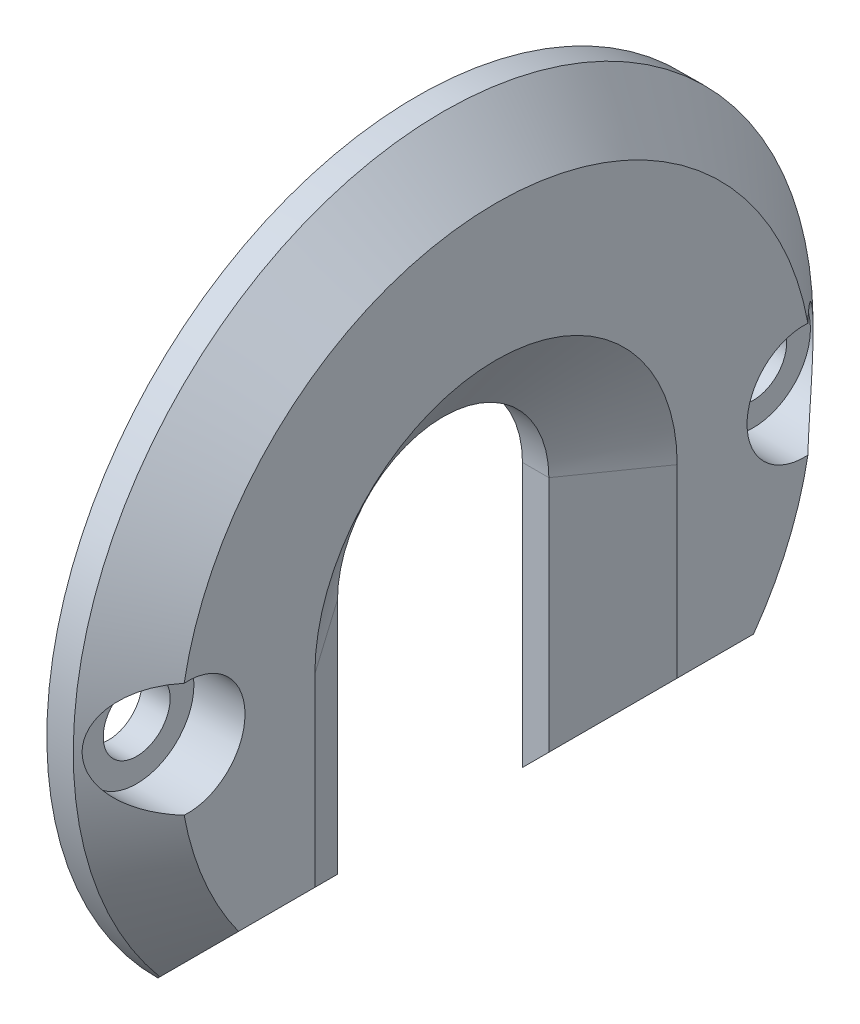
from build123d import *
from OCP.BRepFilletAPI import BRepFilletAPI_MakeChamfer

# Parameters (mm, degrees)
BOSS_EXTRUDE1_DEPTH                                 = 4.5
BOSS_EXTRUDE2_REACH                                 = 32.037
BOSS_EXTRUDE2_END_RADIUS                            = 21
BOSS_EXTRUDE2_DIRECTION_2_REACH                     = 32.037
BOSS_EXTRUDE2_DIRECTION_2_END_RADIUS                = 21
CUT_EXTRUDE1_REACH                                  = 32.037
CUT_EXTRUDE1_DIRECTION_2_REACH                      = 32.037
CBORE_FOR_M3_HEX_SOCKET_HEAD_CAP_SCREW1_D           = 3.8
CBORE_FOR_M3_HEX_SOCKET_HEAD_CAP_SCREW1_DEPTH       = 7
CBORE_FOR_M3_HEX_SOCKET_HEAD_CAP_SCREW1_CBORE_D     = 6.5
CBORE_FOR_M3_HEX_SOCKET_HEAD_CAP_SCREW1_CBORE_DEPTH = 2.9
CBORE_FOR_M3_HEX_SOCKET_HEAD_CAP_SCREW1_TIP         = 1.141635176
CHAMFER1_SIZE                                       = 3
CHAMFER1_SIZE2                                      = 4.28444402
CHAMFER2_SIZE                                       = 3


with BuildPart() as part:
    # Sketch1 → Boss-Extrude1 (new body)
    with BuildSketch(Plane(origin=(0, 0, 0), x_dir=(0, 0, -1), z_dir=(1, 0, 0))):
        with BuildLine():
            Line((-6, -10.5), (-6, 0))
            ThreePointArc((-6, 0), (0, 6), (6, 0))
            Line((6, 0), (6, -10.5))
            Line((6, -10.5), (18.186533479, -10.5))
            ThreePointArc((18.186533479, -10.5), (0, 21), (-18.186533479, -10.5))
            Line((-18.186533479, -10.5), (-6, -10.5))
        make_face()
    extrude(amount=BOSS_EXTRUDE1_DEPTH)

    # Boss-Extrude2: up to this cylinder (the profile starts inside it)
    boss_extrude2_end = Plane(origin=(1.5, 0, 0), z_dir=(-1, 0, 0)) * Cylinder(BOSS_EXTRUDE2_END_RADIUS, 107.074, mode=Mode.PRIVATE)
    # Sketch2 → Boss-Extrude2 (add, up to the surface)
    with BuildSketch(Plane.XY, mode=Mode.PRIVATE) as boss_extrude2_sk1:
        Polygon((4.5, -10.5), (0, -15), (0, -10.5), align=None)
    boss_extrude2_tool1 = extrude(boss_extrude2_sk1.sketch, amount=-BOSS_EXTRUDE2_REACH, mode=Mode.PRIVATE) & boss_extrude2_end
    add(boss_extrude2_tool1.solids().sort_by_distance((1.5, -12, 0))[0])

    # Boss-Extrude2 direction 2: up to this cylinder (the profile starts inside it)
    boss_extrude2_direction_2_end = Plane(origin=(1.5, 0, 0), z_dir=(-1, 0, 0)) * Cylinder(BOSS_EXTRUDE2_DIRECTION_2_END_RADIUS, 107.074, mode=Mode.PRIVATE)
    # Sketch2 → Boss-Extrude2 direction 2 (add, up to the surface)
    with BuildSketch(Plane.XY, mode=Mode.PRIVATE) as boss_extrude2_direction_2_sk1:
        Polygon((4.5, -10.5), (0, -15), (0, -10.5), align=None)
    boss_extrude2_direction_2_tool1 = extrude(boss_extrude2_direction_2_sk1.sketch, amount=BOSS_EXTRUDE2_DIRECTION_2_REACH, mode=Mode.PRIVATE) & boss_extrude2_direction_2_end
    add(boss_extrude2_direction_2_tool1.solids().sort_by_distance((1.5, -12, 0))[0])

    # Cut-Extrude1: up to this face of the body (flat: up to its plane)
    cut_extrude1_end = Plane(part.part.faces().sort_by_distance((2.25, -5.25, -6))[0])
    # Sketch2<2> → Cut-Extrude1 (cut, up to the picked face)
    with BuildSketch(Plane.XY, mode=Mode.PRIVATE) as cut_extrude1_sk1:
        Polygon((4.5, -10.5), (0, -15), (0, -10.5), align=None)
    cut_extrude1_tool1 = split(extrude(cut_extrude1_sk1.sketch, amount=-CUT_EXTRUDE1_REACH, mode=Mode.PRIVATE), bisect_by=cut_extrude1_end, keep=Keep.BOTH, mode=Mode.PRIVATE)
    add(cut_extrude1_tool1.solids().sort_by(Axis((1.5, -12, 0), (0, 0, -1)))[0], mode=Mode.SUBTRACT)

    # Cut-Extrude1 direction 2: up to this face of the body (flat: up to its plane)
    cut_extrude1_direction_2_end = Plane(part.part.faces().sort_by_distance((2.25, -5.25, 6))[0])
    # Sketch2<2> → Cut-Extrude1 direction 2 (cut, up to the picked face)
    with BuildSketch(Plane.XY, mode=Mode.PRIVATE) as cut_extrude1_direction_2_sk1:
        Polygon((4.5, -10.5), (0, -15), (0, -10.5), align=None)
    cut_extrude1_direction_2_tool1 = split(extrude(cut_extrude1_direction_2_sk1.sketch, amount=CUT_EXTRUDE1_DIRECTION_2_REACH, mode=Mode.PRIVATE), bisect_by=cut_extrude1_direction_2_end, keep=Keep.BOTH, mode=Mode.PRIVATE)
    add(cut_extrude1_direction_2_tool1.solids().sort_by(Axis((1.5, -12, 0), (0, 0, 1)))[0], mode=Mode.SUBTRACT)

    # CBORE for M3 Hex Socket Head Cap Screw1
    with Locations(Plane(origin=(4.5, 0, 0), x_dir=(0, 0, -1), z_dir=(1, 0, 0))):
        with Locations((-17.5, 0), (17.5, 0)):
            CounterBoreHole(CBORE_FOR_M3_HEX_SOCKET_HEAD_CAP_SCREW1_D / 2, CBORE_FOR_M3_HEX_SOCKET_HEAD_CAP_SCREW1_CBORE_D / 2, CBORE_FOR_M3_HEX_SOCKET_HEAD_CAP_SCREW1_CBORE_DEPTH, depth=CBORE_FOR_M3_HEX_SOCKET_HEAD_CAP_SCREW1_DEPTH)
            with Locations((0, 0, -(CBORE_FOR_M3_HEX_SOCKET_HEAD_CAP_SCREW1_DEPTH + CBORE_FOR_M3_HEX_SOCKET_HEAD_CAP_SCREW1_TIP / 2))):  # 118° drill point
                Cone(0, CBORE_FOR_M3_HEX_SOCKET_HEAD_CAP_SCREW1_D / 2, CBORE_FOR_M3_HEX_SOCKET_HEAD_CAP_SCREW1_TIP, mode=Mode.SUBTRACT)

    # Chamfer1: one chamfer whose edges measure the first distance from different faces: ONE call of the kernel's chamfer builder (chamfer() names one face for all edges)
    chamfer1_edges_1 = [part.edges().sort_by_distance(p)[0] for p in [
        (4.5, -5.25, 6),
    ]]
    chamfer1_side_1 = [part.faces().sort_by_distance(p)[0] for p in [
        (2.117647059, -6.441176471, 6),
    ]]
    chamfer1_edges_2 = [part.edges().sort_by_distance(p)[0] for p in [
        (4.5, 6, 0),
    ]]
    chamfer1_side_2 = [part.faces().sort_by_distance(p)[0] for p in [
        (2.25, 6, 0),
    ]]
    chamfer1_edges_3 = [part.edges().sort_by_distance(p)[0] for p in [
        (4.5, -5.25, -6),
    ]]
    chamfer1_side_3 = [part.faces().sort_by_distance(p)[0] for p in [
        (2.117647059, -6.441176471, -6),
    ]]
    chamfer1 = BRepFilletAPI_MakeChamfer(part.part.solid().wrapped)
    for e in chamfer1_edges_1:
        chamfer1.Add(CHAMFER1_SIZE, CHAMFER1_SIZE2, e.wrapped, chamfer1_side_1[0].wrapped)  # the first distance lies on this face
    for e in chamfer1_edges_2:
        chamfer1.Add(CHAMFER1_SIZE, CHAMFER1_SIZE2, e.wrapped, chamfer1_side_2[0].wrapped)  # the first distance lies on this face
    for e in chamfer1_edges_3:
        chamfer1.Add(CHAMFER1_SIZE, CHAMFER1_SIZE2, e.wrapped, chamfer1_side_3[0].wrapped)  # the first distance lies on this face
    add(Compound.cast(chamfer1.Shape()), mode=Mode.REPLACE)

    # Chamfer2
    # the kernel refuses this chamfer: 3 mm, written as the material it takes off along each edge
    with BuildSketch(Plane(origin=(4.5, 0, 0), x_dir=(0, -0.7783499423883817, -0.6278306835317966), z_dir=(0, -0.6278306835317966, 0.7783499423883817))) as chamfer2_piece_1:
        Polygon((21 - CHAMFER2_SIZE, 0), (21, -CHAMFER2_SIZE), (21, 0), align=None)
    revolve(axis=Axis((4.5, 0, 0), (1, 0, 0)), revolution_arc=282.219489944, mode=Mode.SUBTRACT)


solid = part.part
